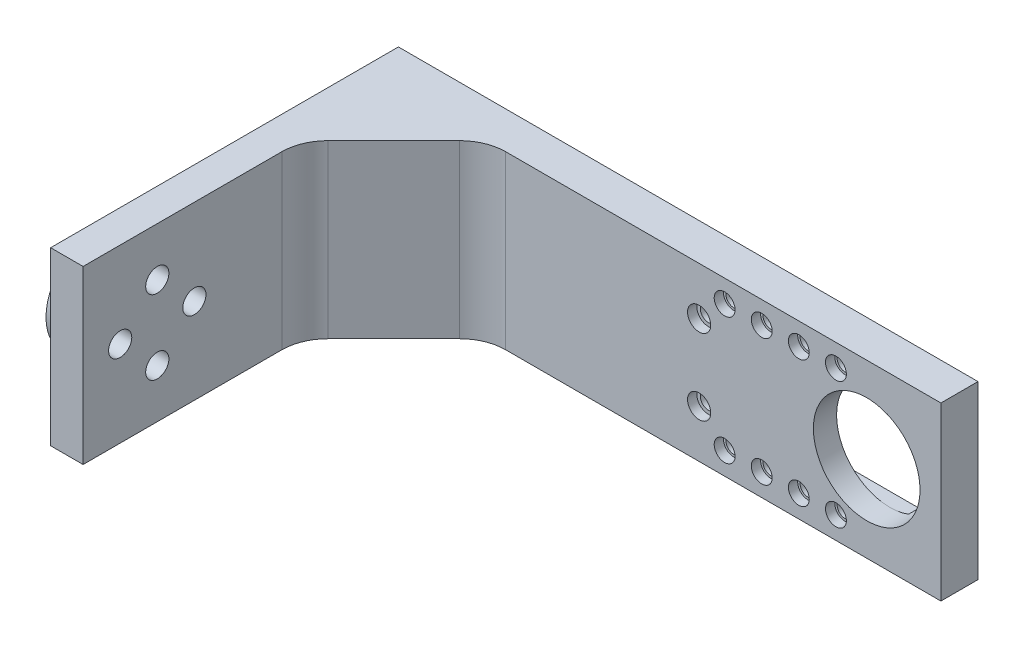
from build123d import *

# Parameters (mm, degrees)
BOSS_EXTRUDE1_DEPTH = 37
CUT_EXTRUDE1_REACH  = 152.396
CUT_EXTRUDE2_REACH  = 152.396
SKETCH3_R           = 1.75
CUT_EXTRUDE5_REACH  = 152.396
SKETCH5_R           = 1.75
BOSS_EXTRUDE3_START = 6
SKETCH6_R           = 11
SKETCH6_R_2         = 1.75
BOSS_EXTRUDE3_DEPTH = 6
SKETCH4_W           = 38
SKETCH4_H           = 23
CUT_EXTRUDE6_DEPTH  = 3
SKETCH9_R           = 2.25
CUT_EXTRUDE8_DEPTH  = 2
SKETCH10_R          = 2.5
CUT_EXTRUDE9_DEPTH  = 5
CHAMFER1_SIZE       = 20
FILLET5_R           = 10
CUT_EXTRUDE10_REACH = 148.571
SKETCH11_R          = 1.75
SKETCH12_R          = 2.5
CUT_EXTRUDE11_DEPTH = 2
SKETCH7_W           = 3
SKETCH7_H           = 23
BOSS_EXTRUDE4_DEPTH = 0.5


with BuildPart() as part:
    # Sketch1 → Boss-Extrude1 (new body)
    with BuildSketch(Plane(origin=(0, 0, 0), x_dir=(1, 0, 0), z_dir=(0, 1, 0))):
        Polygon((0, 0), (0, 75), (125, 75), (125, 67), (7, 67), (7, 0), align=None)
    extrude(amount=BOSS_EXTRUDE1_DEPTH)

    # Sketch2 → Cut-Extrude1 (cut, up to next)
    with BuildSketch(Plane(origin=(0, 0, -75), x_dir=(-1, 0, 0), z_dir=(0, 0, -1)), mode=Mode.PRIVATE) as cut_extrude1_sk1:
        with BuildLine():
            ThreePointArc((-120.5, 18.5), (-109, 7), (-97.5, 18.5))
            ThreePointArc((-97.5, 18.5), (-109, 30), (-120.5, 18.5))
        make_face()
    cut_extrude1_tool1 = extrude(cut_extrude1_sk1.sketch, amount=-CUT_EXTRUDE1_REACH, mode=Mode.PRIVATE) & part.part
    add(cut_extrude1_tool1.solids().sort_by_distance((109, 18.5, -75))[0], mode=Mode.SUBTRACT)

    # Sketch3 → Cut-Extrude2 (cut, up to next)
    with BuildSketch(Plane(origin=(0, 0, -75), x_dir=(-1, 0, 0), z_dir=(0, 0, -1)), mode=Mode.PRIVATE) as cut_extrude2_sk1:
        with Locations((-102.36, 32.19)):
            Circle(SKETCH3_R)
    cut_extrude2_tool1 = extrude(cut_extrude2_sk1.sketch, amount=-CUT_EXTRUDE2_REACH, mode=Mode.PRIVATE) & part.part
    # Sketch3 → Cut-Extrude2 (cut, up to next)
    with BuildSketch(Plane(origin=(0, 0, -75), x_dir=(-1, 0, 0), z_dir=(0, 0, -1)), mode=Mode.PRIVATE) as cut_extrude2_sk2:
        with Locations((-94.36, 32.19)):
            Circle(SKETCH3_R)
    cut_extrude2_tool2 = extrude(cut_extrude2_sk2.sketch, amount=-CUT_EXTRUDE2_REACH, mode=Mode.PRIVATE) & part.part
    # Sketch3 → Cut-Extrude2 (cut, up to next)
    with BuildSketch(Plane(origin=(0, 0, -75), x_dir=(-1, 0, 0), z_dir=(0, 0, -1)), mode=Mode.PRIVATE) as cut_extrude2_sk3:
        with Locations((-86.36, 32.19)):
            Circle(SKETCH3_R)
    cut_extrude2_tool3 = extrude(cut_extrude2_sk3.sketch, amount=-CUT_EXTRUDE2_REACH, mode=Mode.PRIVATE) & part.part
    # Sketch3 → Cut-Extrude2 (cut, up to next)
    with BuildSketch(Plane(origin=(0, 0, -75), x_dir=(-1, 0, 0), z_dir=(0, 0, -1)), mode=Mode.PRIVATE) as cut_extrude2_sk4:
        with Locations((-78.36, 32.19)):
            Circle(SKETCH3_R)
    cut_extrude2_tool4 = extrude(cut_extrude2_sk4.sketch, amount=-CUT_EXTRUDE2_REACH, mode=Mode.PRIVATE) & part.part
    # Sketch3 → Cut-Extrude2 (cut, up to next)
    with BuildSketch(Plane(origin=(0, 0, -75), x_dir=(-1, 0, 0), z_dir=(0, 0, -1)), mode=Mode.PRIVATE) as cut_extrude2_sk5:
        with Locations((-78.36, 4.81)):
            Circle(SKETCH3_R)
    cut_extrude2_tool5 = extrude(cut_extrude2_sk5.sketch, amount=-CUT_EXTRUDE2_REACH, mode=Mode.PRIVATE) & part.part
    # Sketch3 → Cut-Extrude2 (cut, up to next)
    with BuildSketch(Plane(origin=(0, 0, -75), x_dir=(-1, 0, 0), z_dir=(0, 0, -1)), mode=Mode.PRIVATE) as cut_extrude2_sk6:
        with Locations((-86.36, 4.81)):
            Circle(SKETCH3_R)
    cut_extrude2_tool6 = extrude(cut_extrude2_sk6.sketch, amount=-CUT_EXTRUDE2_REACH, mode=Mode.PRIVATE) & part.part
    # Sketch3 → Cut-Extrude2 (cut, up to next)
    with BuildSketch(Plane(origin=(0, 0, -75), x_dir=(-1, 0, 0), z_dir=(0, 0, -1)), mode=Mode.PRIVATE) as cut_extrude2_sk7:
        with Locations((-94.36, 4.81)):
            Circle(SKETCH3_R)
    cut_extrude2_tool7 = extrude(cut_extrude2_sk7.sketch, amount=-CUT_EXTRUDE2_REACH, mode=Mode.PRIVATE) & part.part
    # Sketch3 → Cut-Extrude2 (cut, up to next)
    with BuildSketch(Plane(origin=(0, 0, -75), x_dir=(-1, 0, 0), z_dir=(0, 0, -1)), mode=Mode.PRIVATE) as cut_extrude2_sk8:
        with Locations((-102.36, 4.81)):
            Circle(SKETCH3_R)
    cut_extrude2_tool8 = extrude(cut_extrude2_sk8.sketch, amount=-CUT_EXTRUDE2_REACH, mode=Mode.PRIVATE) & part.part
    add(cut_extrude2_tool1.solids().sort_by_distance((102.36, 32.19, -75))[0], mode=Mode.SUBTRACT)
    add(cut_extrude2_tool2.solids().sort_by_distance((94.36, 32.19, -75))[0], mode=Mode.SUBTRACT)
    add(cut_extrude2_tool3.solids().sort_by_distance((86.36, 32.19, -75))[0], mode=Mode.SUBTRACT)
    add(cut_extrude2_tool4.solids().sort_by_distance((78.36, 32.19, -75))[0], mode=Mode.SUBTRACT)
    add(cut_extrude2_tool5.solids().sort_by_distance((78.36, 4.81, -75))[0], mode=Mode.SUBTRACT)
    add(cut_extrude2_tool6.solids().sort_by_distance((86.36, 4.81, -75))[0], mode=Mode.SUBTRACT)
    add(cut_extrude2_tool7.solids().sort_by_distance((94.36, 4.81, -75))[0], mode=Mode.SUBTRACT)
    add(cut_extrude2_tool8.solids().sort_by_distance((102.36, 4.81, -75))[0], mode=Mode.SUBTRACT)

    # Sketch5 → Cut-Extrude5 (cut, up to next)
    with BuildSketch(Plane.ZY, mode=Mode.PRIVATE) as cut_extrude5_sk1:
        with Locations((-16, 10.5)):
            Circle(SKETCH5_R)
    cut_extrude5_tool1 = extrude(cut_extrude5_sk1.sketch, amount=-CUT_EXTRUDE5_REACH, mode=Mode.PRIVATE) & part.part
    # Sketch5 → Cut-Extrude5 (cut, up to next)
    with BuildSketch(Plane.ZY, mode=Mode.PRIVATE) as cut_extrude5_sk2:
        with Locations((-24, 18.5)):
            Circle(SKETCH5_R)
    cut_extrude5_tool2 = extrude(cut_extrude5_sk2.sketch, amount=-CUT_EXTRUDE5_REACH, mode=Mode.PRIVATE) & part.part
    # Sketch5 → Cut-Extrude5 (cut, up to next)
    with BuildSketch(Plane.ZY, mode=Mode.PRIVATE) as cut_extrude5_sk3:
        with Locations((-16, 26.5)):
            Circle(SKETCH5_R)
    cut_extrude5_tool3 = extrude(cut_extrude5_sk3.sketch, amount=-CUT_EXTRUDE5_REACH, mode=Mode.PRIVATE) & part.part
    # Sketch5 → Cut-Extrude5 (cut, up to next)
    with BuildSketch(Plane.ZY, mode=Mode.PRIVATE) as cut_extrude5_sk4:
        with Locations((-8, 18.5)):
            Circle(SKETCH5_R)
    cut_extrude5_tool4 = extrude(cut_extrude5_sk4.sketch, amount=-CUT_EXTRUDE5_REACH, mode=Mode.PRIVATE) & part.part
    add(cut_extrude5_tool1.solids().sort_by_distance((0, 10.5, -16))[0], mode=Mode.SUBTRACT)
    add(cut_extrude5_tool2.solids().sort_by_distance((0, 18.5, -24))[0], mode=Mode.SUBTRACT)
    add(cut_extrude5_tool3.solids().sort_by_distance((0, 26.5, -16))[0], mode=Mode.SUBTRACT)
    add(cut_extrude5_tool4.solids().sort_by_distance((0, 18.5, -8))[0], mode=Mode.SUBTRACT)

    # Sketch6 → Boss-Extrude3 (add)
    with BuildSketch(Plane.ZY.offset(BOSS_EXTRUDE3_START)):
        with Locations((-16, 18.5)):
            Circle(SKETCH6_R)
        with Locations((-16, 10.5)):
            Circle(SKETCH6_R_2, mode=Mode.SUBTRACT)
        with BuildLine():
            ThreePointArc((-9.75, 18.5), (-8, 20.25), (-6.25, 18.5))
            ThreePointArc((-6.25, 18.5), (-8, 16.75), (-9.75, 18.5))
        make_face(mode=Mode.SUBTRACT)
        with Locations((-24, 18.5)):
            Circle(SKETCH6_R_2, mode=Mode.SUBTRACT)
        with Locations((-16, 26.5)):
            Circle(SKETCH6_R_2, mode=Mode.SUBTRACT)
    extrude(amount=-BOSS_EXTRUDE3_DEPTH)

    # Sketch4 → Cut-Extrude6 (cut)
    with BuildSketch(Plane(origin=(0, 0, -75), x_dir=(-1, 0, 0), z_dir=(0, 0, -1))):
        with Locations((-94, 18.5)):
            Rectangle(SKETCH4_W, SKETCH4_H)
    extrude(amount=-CUT_EXTRUDE6_DEPTH, mode=Mode.SUBTRACT)

    # Sketch9 → Cut-Extrude8 (cut)
    with BuildSketch(Plane.XY.offset(-67)):
        with Locations((78.36, 32.19)):
            Circle(SKETCH9_R)
        with Locations((86.36, 32.19)):
            Circle(SKETCH9_R)
        with Locations((94.36, 32.19)):
            Circle(SKETCH9_R)
        with Locations((102.36, 32.19)):
            Circle(SKETCH9_R)
        with Locations((78.36, 4.81)):
            Circle(SKETCH9_R)
        with Locations((86.36, 4.81)):
            Circle(SKETCH9_R)
        with Locations((94.36, 4.81)):
            Circle(SKETCH9_R)
        with Locations((102.36, 4.81)):
            Circle(SKETCH9_R)
    extrude(amount=-CUT_EXTRUDE8_DEPTH, mode=Mode.SUBTRACT)

    # Sketch10 → Cut-Extrude9 (cut)
    with BuildSketch(Plane(origin=(7, 0, 0), x_dir=(0, 0, -1), z_dir=(1, 0, 0))):
        with Locations((24, 18.5)):
            Circle(SKETCH10_R)
        with Locations((16, 10.5)):
            Circle(SKETCH10_R)
        with Locations((8, 18.5)):
            Circle(SKETCH10_R)
        with Locations((16, 26.5)):
            Circle(SKETCH10_R)
    extrude(amount=-CUT_EXTRUDE9_DEPTH, mode=Mode.SUBTRACT)

    # Chamfer1
    chamfer1_edges = [part.edges().sort_by_distance(p)[0] for p in [
        (7, 18.5, -67),
    ]]
    chamfer(chamfer1_edges, length=CHAMFER1_SIZE)

    # Fillet5
    fillet5_edges = [part.edges().sort_by_distance(p)[0] for p in [
        (7, 18.5, -47),
        (27, 18.5, -67),
    ]]
    fillet(fillet5_edges, radius=FILLET5_R)

    # Sketch11 → Cut-Extrude10 (cut, up to next)
    with BuildSketch(Plane.XY.offset(-67), mode=Mode.PRIVATE) as cut_extrude10_sk1:
        with Locations((72.86, 10.31)):
            Circle(SKETCH11_R)
    cut_extrude10_tool1 = extrude(cut_extrude10_sk1.sketch, amount=-CUT_EXTRUDE10_REACH, mode=Mode.PRIVATE) & part.part
    # Sketch11 → Cut-Extrude10 (cut, up to next)
    with BuildSketch(Plane.XY.offset(-67), mode=Mode.PRIVATE) as cut_extrude10_sk2:
        with Locations((72.86, 26.69)):
            Circle(SKETCH11_R)
    cut_extrude10_tool2 = extrude(cut_extrude10_sk2.sketch, amount=-CUT_EXTRUDE10_REACH, mode=Mode.PRIVATE) & part.part
    add(cut_extrude10_tool1.solids().sort_by_distance((72.86, 10.31, -67))[0], mode=Mode.SUBTRACT)
    add(cut_extrude10_tool2.solids().sort_by_distance((72.86, 26.69, -67))[0], mode=Mode.SUBTRACT)

    # Sketch12 → Cut-Extrude11 (cut)
    with BuildSketch(Plane.XY.offset(-67)):
        with Locations((72.86, 10.31)):
            Circle(SKETCH12_R)
        with Locations((72.86, 26.69)):
            Circle(SKETCH12_R)
    extrude(amount=-CUT_EXTRUDE11_DEPTH, mode=Mode.SUBTRACT)

    # Sketch7 → Boss-Extrude4 (add)
    with BuildSketch(Plane(origin=(75, 0, 0), x_dir=(0, 0, -1), z_dir=(1, 0, 0))):
        with Locations((73.5, 18.5)):
            Rectangle(SKETCH7_W, SKETCH7_H)
    extrude(amount=BOSS_EXTRUDE4_DEPTH)


solid = part.part
